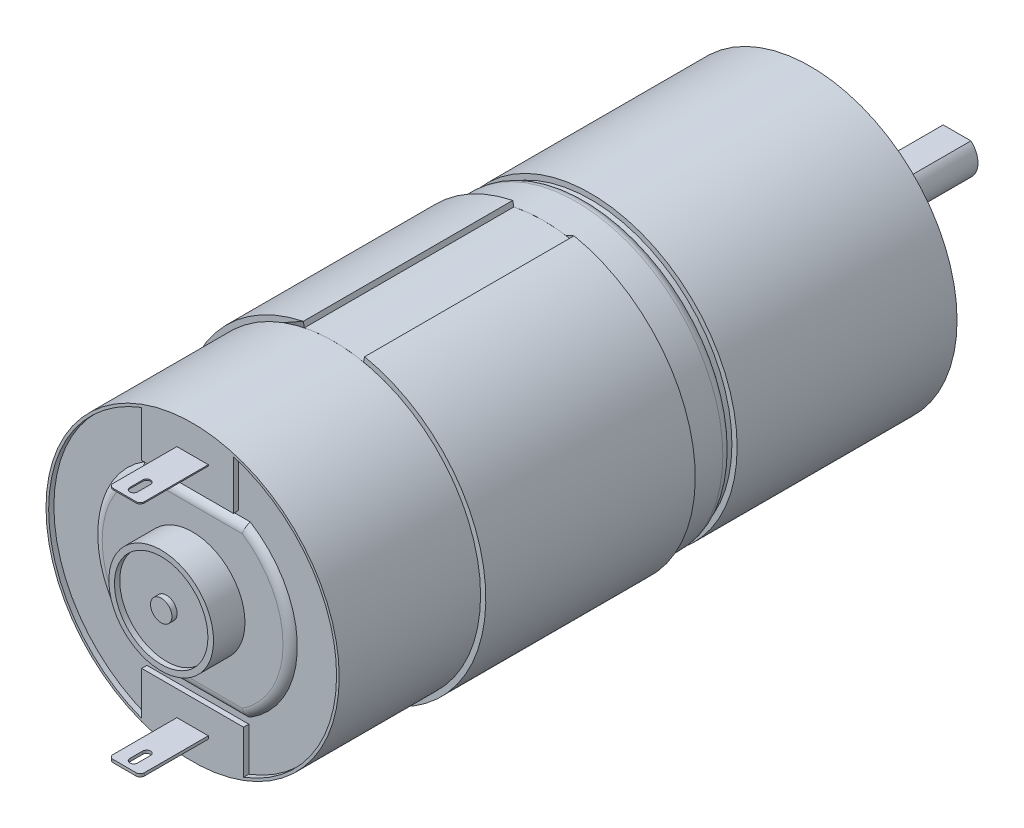
from build123d import *

# Parameters (mm, degrees)
SKETCH1_R            = 14
BOSS_EXTRUDE1_DEPTH  = 21
SKETCH2_R            = 13.5
BOSS_EXTRUDE2_DEPTH  = 0.5
SKETCH3_R            = 14
BOSS_EXTRUDE3_DEPTH  = 4
SKETCH4_R            = 14.5
BOSS_EXTRUDE4_DEPTH  = 20
SKETCH5_R            = 14
BOSS_EXTRUDE5_DEPTH  = 13
FILLET1_R            = 1
SKETCH6_R            = 14
SKETCH6_R_2          = 13.74791831
BOSS_EXTRUDE6_DEPTH  = 0.5
FILLET2_R            = 1
SKETCH7_R            = 5
BOSS_EXTRUDE7_DEPTH  = 3
SKETCH8_R            = 4.460837006
SKETCH8_R_2          = 1.021238478
CUT_EXTRUDE1_DEPTH   = 0.5
BOSS_EXTRUDE8_DEPTH  = 0.5
SKETCH10_W           = 3
SKETCH10_H           = 0.113026654
SKETCH10_H_2         = 0.277660136
BOSS_EXTRUDE9_DEPTH  = 6.5
FILLET3_R            = 0.4
CUT_EXTRUDE2_DEPTH   = 72.907798758
CUT_EXTRUDE3_DEPTH   = 0.1
CIRPATTERN1_COUNT    = 4
CUT_EXTRUDE4_DEPTH   = 45.949972191
SKETCH15_R           = 3.5
BOSS_EXTRUDE10_DEPTH = 2
SKETCH16_R           = 2
BOSS_EXTRUDE11_DEPTH = 12
CUT_EXTRUDE7_START   = -10
CUT_EXTRUDE7_DEPTH   = 10
SKETCH18_R           = 1.5
CUT_EXTRUDE8_DEPTH   = 10


with BuildPart() as part:
    # Sketch1 → Boss-Extrude1 (new body)
    with BuildSketch(Plane.XY):
        with Locations(Location((0, 0, 0), (0, 0, 180))):
            Circle(SKETCH1_R)
    extrude(amount=BOSS_EXTRUDE1_DEPTH)

    # Sketch2 → Boss-Extrude2 (add)
    with BuildSketch(Plane.XY.offset(21)):
        Circle(SKETCH2_R)
    extrude(amount=BOSS_EXTRUDE2_DEPTH)

    # Sketch3 → Boss-Extrude3 (add)
    with BuildSketch(Plane.XY.offset(21.5)):
        with Locations(Location((0, 0, 0), (0, 0, 180))):
            Circle(SKETCH3_R)
    extrude(amount=BOSS_EXTRUDE3_DEPTH)

    # Sketch4 → Boss-Extrude4 (add)
    with BuildSketch(Plane.XY.offset(25.5)):
        Circle(SKETCH4_R)
    extrude(amount=BOSS_EXTRUDE4_DEPTH)

    # Sketch5 → Boss-Extrude5 (add)
    with BuildSketch(Plane.XY.offset(45.5)):
        with Locations(Location((0, 0, 0), (0, 0, 180))):
            Circle(SKETCH5_R)
    extrude(amount=BOSS_EXTRUDE5_DEPTH)

    # Fillet1
    # the kernel refuses this fillet: 1 mm, written as the material it takes off along each edge
    with BuildSketch(Plane(origin=(0, 0, 21.5), x_dir=(-1, 0, 0), z_dir=(0, 1, 0))) as fillet1_piece_1:
        with BuildLine():
            CenterArc((13, 0.866025404), FILLET1_R, 300, 60)
            Line((13.5, 0), (13.51, -0.017320508))
            ThreePointArc((13.51, -0.017320508), (13.75, -0.02), (14, -0.02))
            Line((14, -0.02), (14.02, 0))
            Line((14.02, 0), (14.02, 0.866025404))
            Line((14.02, 0.866025404), (14, 0.866025404))
        make_face()
    revolve(axis=Axis((0, 0, 21.5), (0, 0, 1)), mode=Mode.SUBTRACT)

    # Sketch6 → Boss-Extrude6 (add)
    # profile 1 of 2: a face of its own
    with BuildSketch(Plane.XY.offset(58.5)):
        with Locations(Location((0, 0, 0), (0, 0, 180))):
            Circle(SKETCH6_R)
        Circle(SKETCH6_R_2, mode=Mode.SUBTRACT)
    # profile 2 of 2: a face of its own
    with BuildSketch(Plane.XY.offset(58.5)):
        with BuildLine():
            Line((-5, -8.077747211), (5, -8.077747211))
            ThreePointArc((5, -8.077747211), (9.5, 0), (5, 8.077747211))
            Line((5, 8.077747211), (-5, 8.077747211))
            ThreePointArc((-5, 8.077747211), (-9.5, 0), (-5, -8.077747211))
        make_face()
    extrude(amount=BOSS_EXTRUDE6_DEPTH)

    # Fillet2
    # the kernel refuses this fillet: 1 mm, written as the material it takes off along each edge
    with BuildSketch(Plane(origin=(0, 0, 59), x_dir=(-0.3204523861035329, 0.9472646241893299, 0), z_dir=(0.9472646241893299, 0.3204523861035329, 0))) as fillet2_piece_1:
        with BuildLine():
            CenterArc((8.633974596, -1), FILLET2_R, 30, 60)
            Line((9.5, -0.5), (9.517320508, -0.49))
            ThreePointArc((9.517320508, -0.49), (9.52, -0.25), (9.52, 0))
            Line((9.52, 0), (9.5, 0.02))
            Line((9.5, 0.02), (8.633974596, 0.02))
            Line((8.633974596, 0.02), (8.633974596, 0))
        make_face()
    revolve(axis=Axis((0, 0, 59), (0, 0, 1)), revolution_arc=142.619429044, mode=Mode.SUBTRACT)
    with BuildSketch(Plane(origin=(7.165063509, 8.077747211, 59), x_dir=(0, -1, 0), z_dir=(-1, 0, 0)), Plane(origin=(-7.165063509, -8.077747211, 59), x_dir=(0, 1, 0), z_dir=(1, 0, 0))) as fillet2_piece_2:
        with BuildLine():
            CenterArc((0.866025404, -1), FILLET2_R, 90, 60)
            Line((0, -0.5), (-0.017320508, -0.49))
            ThreePointArc((-0.017320508, -0.49), (-0.02, -0.25), (-0.02, 0))
            Line((-0.02, 0), (0, 0.02))
            Line((0, 0.02), (0.866025404, 0.02))
            Line((0.866025404, 0.02), (0.866025404, 0))
        make_face()
    extrude(amount=14.330127019, mode=Mode.SUBTRACT)
    with BuildSketch(Plane(origin=(0, 0, 59), x_dir=(0.3204523861035327, -0.9472646241893299, 0), z_dir=(-0.9472646241893299, -0.3204523861035327, 0))) as fillet2_piece_3:
        with BuildLine():
            CenterArc((8.633974596, -1), FILLET2_R, 30, 60)
            Line((8.633974596, 0), (8.633974596, 0.02))
            Line((8.633974596, 0.02), (9.5, 0.02))
            Line((9.5, 0.02), (9.52, 0))
            ThreePointArc((9.52, 0), (9.52, -0.25), (9.517320508, -0.49))
            Line((9.517320508, -0.49), (9.5, -0.5))
        make_face()
    revolve(axis=Axis((0, 0, 59), (0, 0, 1)), revolution_arc=142.619429044, mode=Mode.SUBTRACT)

    # Sketch7 → Boss-Extrude7 (add)
    with BuildSketch(Plane.XY.offset(59)):
        Circle(SKETCH7_R)
    extrude(amount=BOSS_EXTRUDE7_DEPTH)

    # Sketch8 → Cut-Extrude1 (cut)
    with BuildSketch(Plane.XY.offset(62)):
        Circle(SKETCH8_R)
        Circle(SKETCH8_R_2, mode=Mode.SUBTRACT)
    extrude(amount=-CUT_EXTRUDE1_DEPTH, mode=Mode.SUBTRACT)

    # Sketch9 → Boss-Extrude8 (add)
    with BuildSketch(Plane.XY.offset(58.5)):
        with BuildLine():
            Line((-4.864481732, 12.858540949), (-4.864481732, 8.474731605))
            Line((-4.864481732, 8.474731605), (3.898597634, 8.474731605))
            Line((3.898597634, 8.474731605), (3.898597634, 13.183557727))
            ThreePointArc((3.898597634, 13.183557727), (-0.509550782, 13.738472108), (-4.864481732, 12.858540949))
        make_face()
        with BuildLine():
            Line((-4.864481732, -12.858540949), (-4.864481732, -8.717904414))
            Line((-4.864481732, -8.717904414), (4.864481732, -8.717904414))
            Line((4.864481732, -8.717904414), (4.864481732, -12.858540949))
            ThreePointArc((4.864481732, -12.858540949), (0, -13.74791831), (-4.864481732, -12.858540949))
        make_face()
    extrude(amount=BOSS_EXTRUDE8_DEPTH)

    # Sketch10 → Boss-Extrude9 (add)
    with BuildSketch(Plane.XY.offset(59)):
        with Locations((0, 11.25)):
            Rectangle(SKETCH10_W, SKETCH10_H)
        with Locations((0, -11.25)):
            Rectangle(SKETCH10_W, SKETCH10_H_2)
    extrude(amount=BOSS_EXTRUDE9_DEPTH)

    # Fillet3
    fillet3_edges = [part.edges().sort_by_distance(p)[0] for p in [
        (1.5, 11.25, 65.5),
        (-1.5, 11.25, 65.5),
        (1.5, -11.25, 65.5),
        (-1.5, -11.25, 65.5),
    ]]
    fillet(fillet3_edges, radius=FILLET3_R)

    # Sketch11 → Cut-Extrude2 (cut, through all)
    with BuildSketch(Plane.XZ.offset(11.388830068)):
        with BuildLine():
            Line((0.372464769, 64.6226508), (0.372464769, 63.389034489))
            ThreePointArc((0.372464769, 63.389034489), (0, 63.016569721), (-0.372464769, 63.389034489))
            Line((-0.372464769, 63.389034489), (-0.372464769, 64.6226508))
            ThreePointArc((-0.372464769, 64.6226508), (0, 64.995115568), (0.372464769, 64.6226508))
        make_face()
    extrude(amount=-CUT_EXTRUDE2_DEPTH, mode=Mode.SUBTRACT)

    # Sketch12 → Cut-Extrude3 (cut)
    with BuildSketch(Plane(origin=(0, 0, 0), x_dir=(-1, 0, 0), z_dir=(0, 0, -1))):
        with BuildLine():
            Line((2.675792917, 7.20434815), (3.81405727, 10.269029513))
            ThreePointArc((3.81405727, 10.269029513), (4.376615733, 10.847932139), (5.183440496, 10.82275125))
            ThreePointArc((5.183440496, 10.82275125), (8.485281374, 8.485281374), (10.82275125, 5.183440496))
            ThreePointArc((10.82275125, 5.183440496), (10.847932139, 4.376615733), (10.269029513, 3.81405727))
            Line((10.269029513, 3.81405727), (7.20434815, 2.675792917))
            ThreePointArc((7.20434815, 2.675792917), (6.499150933, 2.679127181), (5.971506343, 3.147000475))
            ThreePointArc((5.971506343, 3.147000475), (4.772970773, 4.772970773), (3.147000475, 5.971506343))
            ThreePointArc((3.147000475, 5.971506343), (2.679127181, 6.499150933), (2.675792917, 7.20434815))
        make_face()
    cut_extrude3 = extrude(amount=-CUT_EXTRUDE3_DEPTH, mode=Mode.SUBTRACT)

    # CirPattern1: Cut-Extrude3 ×4 about axis
    cirpattern1_axis = Axis((0, 0, 0), (0, 0, 1))
    for i in range(1, CIRPATTERN1_COUNT):
        add(cut_extrude3.rotate(cirpattern1_axis, i * 360 / CIRPATTERN1_COUNT), mode=Mode.SUBTRACT)

    # Sketch13 → Cut-Extrude4 (cut, through all)
    with BuildSketch(Plane(origin=(0, 0, 25.5), x_dir=(-1, 0, 0), z_dir=(0, 0, -1))):
        with BuildLine():
            Line((-2.824925092, 13.712305557), (-3, 14.536259215))
            ThreePointArc((-3, 14.536259215), (0, 14.842601927), (3, 14.536259215))
            Line((3, 14.536259215), (2.824925092, 13.712305557))
            ThreePointArc((2.824925092, 13.712305557), (0, 14.000268764), (-2.824925092, 13.712305557))
        make_face()
    extrude(amount=-CUT_EXTRUDE4_DEPTH, mode=Mode.SUBTRACT)

    # Sketch15 → Boss-Extrude10 (add)
    with BuildSketch(Plane(origin=(0, 0, 0), x_dir=(-1, 0, 0), z_dir=(0, 0, -1))):
        with Locations(Location((0, 0, 0), (0, 0, 180))):
            Circle(SKETCH15_R)
    extrude(amount=BOSS_EXTRUDE10_DEPTH)

    # Sketch16 → Boss-Extrude11 (add)
    with BuildSketch(Plane(origin=(0, 0, -2), x_dir=(-1, 0, 0), z_dir=(0, 0, -1))):
        Circle(SKETCH16_R)
    extrude(amount=BOSS_EXTRUDE11_DEPTH)

    # Sketch17 → Cut-Extrude7 (cut)
    with BuildSketch(Plane(origin=(0, 0, -14), x_dir=(-1, 0, 0), z_dir=(0, 0, -1)).offset(CUT_EXTRUDE7_START)):
        with BuildLine():
            Line((-1.322875656, 1.5), (1.322875656, 1.5))
            ThreePointArc((1.322875656, 1.5), (0, 2), (-1.322875656, 1.5))
        make_face()
    extrude(amount=CUT_EXTRUDE7_DEPTH, mode=Mode.SUBTRACT)

    # Sketch18 → Cut-Extrude8 (cut)
    with BuildSketch(Plane(origin=(0, 0, 0), x_dir=(-1, 0, 0), z_dir=(0, 0, -1))):
        with Locations((-10, 0)):
            Circle(SKETCH18_R)
        with Locations((10, 0)):
            Circle(SKETCH18_R)
    extrude(amount=-CUT_EXTRUDE8_DEPTH, mode=Mode.SUBTRACT)


solid = part.part
